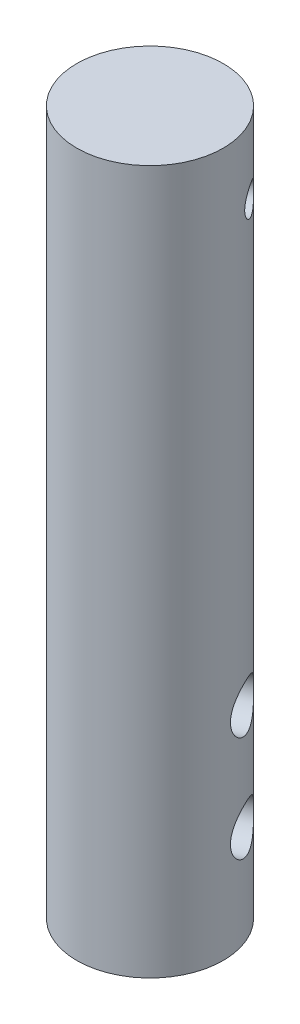
from build123d import *

# Parameters (mm, degrees)
SKETCH1_R                           = 7.9375
BOSS_EXTRUDE1_DEPTH                 = 76.2
F_1_8_0_1250_DOWEL_HOLE1_D          = 3.175
F_1_8_0_1250_DOWEL_HOLE1_DEPTH      = 17.526
F_1_8_0_1250_DOWEL_HOLE1_TIP        = 0.953866233
F_5_0MM_DOWEL_HOLE1_D               = 5
F_5_0MM_DOWEL_HOLE1_DEPTH           = 25.4
F_5_0MM_DOWEL_HOLE1_TIP             = 1.502151548
TAP_DRILL_FOR_1_4_20_TAP1_OUTLINE_R = 2.5527
TAP_DRILL_FOR_1_4_20_TAP1_DEPTH     = 9


with BuildPart() as part:
    # Sketch1 → Boss-Extrude1 (new body)
    with BuildSketch(Plane(origin=(0, 0, 0), x_dir=(1, 0, 0), z_dir=(0, 1, 0))):
        with Locations(Location((0, 0, 0), (0, 0, 90))):
            Circle(SKETCH1_R)
    extrude(amount=BOSS_EXTRUDE1_DEPTH)

    # 1/8 (0.1250) Dowel Hole1
    with Locations(Plane(origin=(6.688476845, 68.670007772, -4.274129589), x_dir=(0.538473019062, 0, 0.842642752145), z_dir=(0.842642752145, 0, -0.538473019062))):
        with Locations((0, 0)):
            Hole(F_1_8_0_1250_DOWEL_HOLE1_D / 2, depth=F_1_8_0_1250_DOWEL_HOLE1_DEPTH)
            with Locations((0, 0, -(F_1_8_0_1250_DOWEL_HOLE1_DEPTH + F_1_8_0_1250_DOWEL_HOLE1_TIP / 2))):  # 118° drill point
                Cone(0, F_1_8_0_1250_DOWEL_HOLE1_D / 2, F_1_8_0_1250_DOWEL_HOLE1_TIP, mode=Mode.SUBTRACT)

    # Ø5.0mm Dowel Hole1
    with Locations(Plane(origin=(0, 0, 0), x_dir=(-1, 0, 0), z_dir=(0, -1, 0))):
        with Locations((0, 0)):
            Hole(F_5_0MM_DOWEL_HOLE1_D / 2, depth=F_5_0MM_DOWEL_HOLE1_DEPTH)
            with Locations((0, 0, -(F_5_0MM_DOWEL_HOLE1_DEPTH + F_5_0MM_DOWEL_HOLE1_TIP / 2))):  # 118° drill point
                Cone(0, F_5_0MM_DOWEL_HOLE1_D / 2, F_5_0MM_DOWEL_HOLE1_TIP, mode=Mode.SUBTRACT)

    # Tap Drill for 1/4-20 Tap1: read off the stored shape, not the designer's step
    # Tap Drill for 1/4-20 Tap1 outline → Tap Drill for 1/4-20 Tap1 (cut)
    with BuildSketch(Plane(origin=(0, 0, 0), x_dir=(0, 1, 0), z_dir=(0.9087676630767977, 0, -0.4173024497243409))):
        with Locations((10.457639215, 0)):
            Circle(TAP_DRILL_FOR_1_4_20_TAP1_OUTLINE_R)
        with Locations((21.887639215, 0)):
            Circle(TAP_DRILL_FOR_1_4_20_TAP1_OUTLINE_R)
    extrude(amount=TAP_DRILL_FOR_1_4_20_TAP1_DEPTH, mode=Mode.SUBTRACT)


solid = part.part
